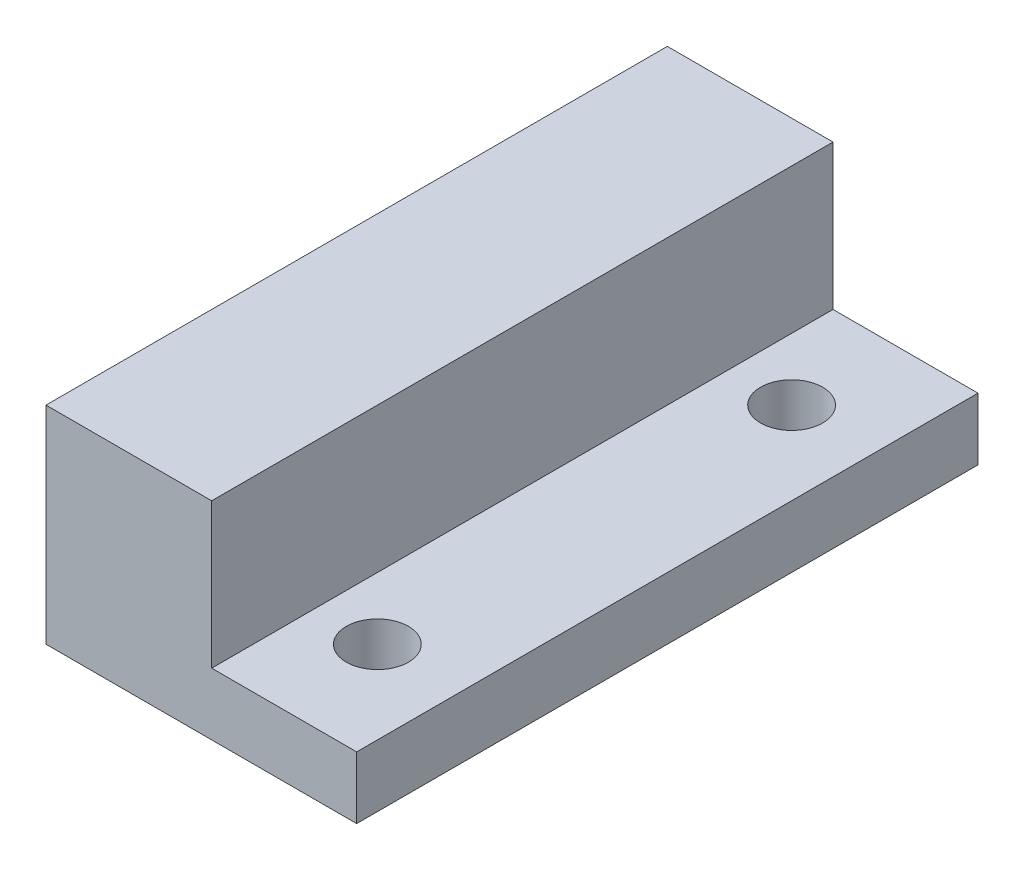
from build123d import *

# Parameters (mm, degrees)
SKETCH1_W           = 19.05
SKETCH1_H           = 38.1
SKETCH1_R           = 1.905
BOSS_EXTRUDE1_DEPTH = 3.81
BOSS_EXTRUDE2_DEPTH = 6.35
SKETCH3_W           = 10.16
SKETCH3_H           = 38.1
BOSS_EXTRUDE3_DEPTH = 2.54
CHAMFER1_SIZE       = 1.27


with BuildPart() as part:
    # Sketch1 → Boss-Extrude1 (new body)
    with BuildSketch(Plane(origin=(0, 0, 0), x_dir=(1, 0, 0), z_dir=(0, 1, 0))):
        with Locations((-4.445, -12.7)):
            Rectangle(SKETCH1_W, SKETCH1_H)
        Circle(SKETCH1_R, mode=Mode.SUBTRACT)
        with Locations((0, -25.4)):
            Circle(SKETCH1_R, mode=Mode.SUBTRACT)
    extrude(amount=BOSS_EXTRUDE1_DEPTH)

    # Sketch2 → Boss-Extrude2 (add)
    with BuildSketch(Plane(origin=(0, 3.81, 0), x_dir=(1, 0, 0), z_dir=(0, 1, 0))):
        Polygon((-13.97, 6.35), (-13.97, -31.75), (-3.81, -31.75), (-3.81, 6.35), (-6.35, 6.35), (-6.35, -29.21), (-11.43, -29.21), (-11.43, 6.35), align=None)
    extrude(amount=BOSS_EXTRUDE2_DEPTH)

    # Sketch3 → Boss-Extrude3 (add)
    with BuildSketch(Plane(origin=(0, 10.16, 0), x_dir=(1, 0, 0), z_dir=(0, 1, 0))):
        with Locations((-8.89, -12.7)):
            Rectangle(SKETCH3_W, SKETCH3_H)
    extrude(amount=BOSS_EXTRUDE3_DEPTH)

    # Chamfer1
    chamfer1_edges = [part.edges().sort_by_distance(p)[0] for p in [
        (-6.35, 10.16, 11.43),
        (-11.43, 10.16, 11.43),
    ]]
    chamfer(chamfer1_edges, length=CHAMFER1_SIZE)


solid = part.part
